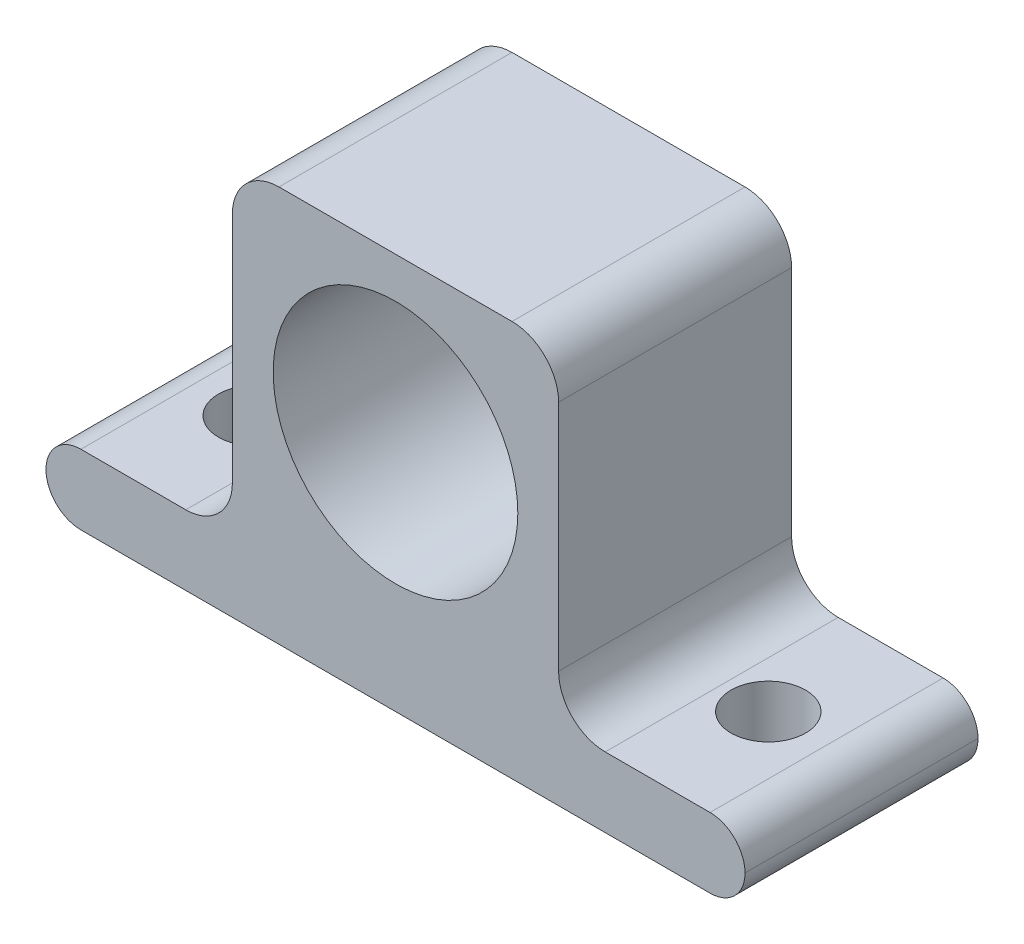
from build123d import *

# Parameters (mm, degrees)
BOSS_EXTRUDE1_DEPTH = 5
SKETCH2_R           = 5.25
CUT_EXTRUDE1_DEPTH  = 25.779023387
SKETCH3_R           = 1.6
CUT_EXTRUDE2_DEPTH  = 22.118712082
FILLET1_R           = 2
FILLET2_R           = 1.5


with BuildPart() as part:
    # Sketch1 → Boss-Extrude1 (new, symmetric)
    with BuildSketch(Plane.XY):
        Polygon((-15, 0), (15, 0), (15, 3), (7, 3), (7, 17), (-7, 17), (-7, 3), (-15, 3), align=None)
    extrude(amount=BOSS_EXTRUDE1_DEPTH, both=True)

    # Sketch2 → Cut-Extrude1 (cut, through all)
    with BuildSketch(Plane.XY.offset(5)):
        with Locations((0, 10)):
            Circle(SKETCH2_R)
    extrude(amount=-CUT_EXTRUDE1_DEPTH, mode=Mode.SUBTRACT)

    # Sketch3 → Cut-Extrude2 (cut, through all)
    with BuildSketch(Plane(origin=(0, 3, 0), x_dir=(1, 0, 0), z_dir=(0, 1, 0))):
        with Locations(Location((11, 0, 0), (0, 0, 180))):
            Circle(SKETCH3_R)
        with Locations(Location((-11, 0, 0), (0, 0, 180))):
            Circle(SKETCH3_R)
    extrude(amount=-CUT_EXTRUDE2_DEPTH, mode=Mode.SUBTRACT)

    # Fillet1
    fillet1_edges = [part.edges().sort_by_distance(p)[0] for p in [
        (-7, 3, 0),
        (-7, 17, 0),
        (7, 17, 0),
        (7, 3, 0),
    ]]
    fillet(fillet1_edges, radius=FILLET1_R)

    # Fillet2
    fillet2_edges = [part.edges().sort_by_distance(p)[0] for p in [
        (-15, 0, 0),
        (-15, 3, 0),
        (15, 3, 0),
        (15, 0, 0),
    ]]
    fillet(fillet2_edges, radius=FILLET2_R - 0.0001)  # a hair under: the kernel refuses the full size


solid = part.part
